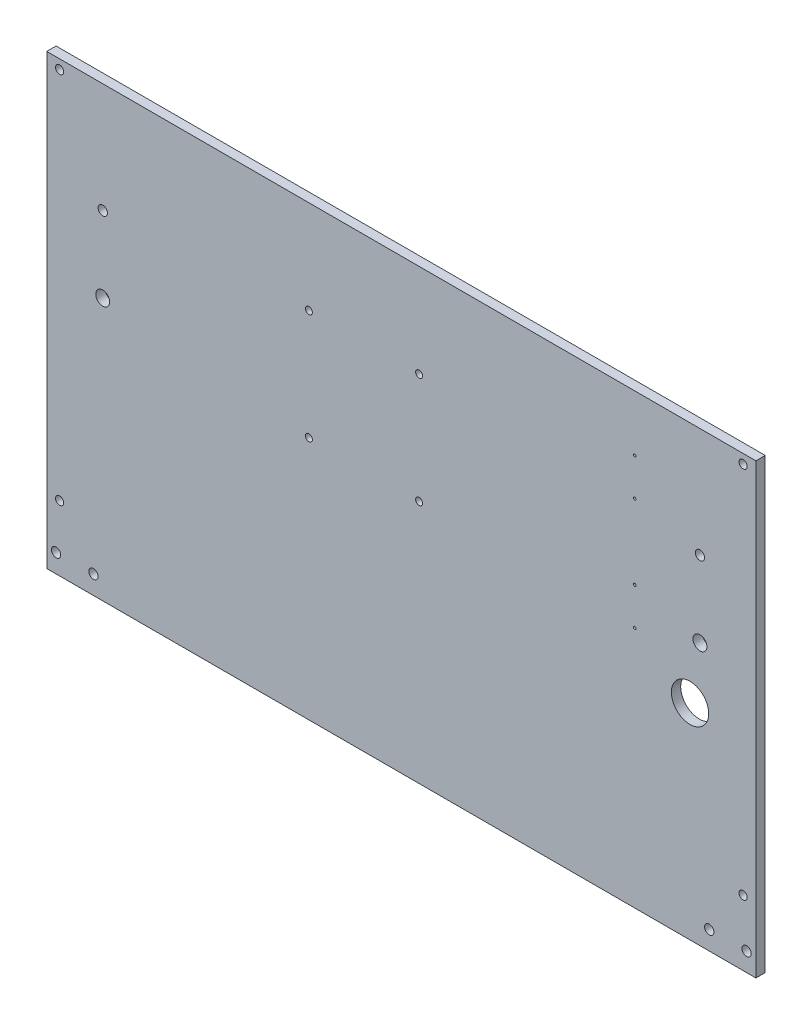
from build123d import *

# Parameters (mm, degrees)
SKETCH1_W           = 482.6
SKETCH1_H           = 304.8
BOSS_EXTRUDE1_DEPTH = 6.35
SKETCH2_R           = 2.7813
CUT_EXTRUDE1_DEPTH  = 286.467638271
SKETCH3_R           = 3.175
CUT_EXTRUDE2_DEPTH  = 286.467638271
SKETCH4_R           = 12.7
CUT_EXTRUDE3_DEPTH  = 286.467638271
SKETCH5_R           = 2.3749
CUT_EXTRUDE4_DEPTH  = 286.467638271
SKETCH6_R           = 3.175
SKETCH6_R_2         = 4.7625
CUT_EXTRUDE5_DEPTH  = 286.467638271
SKETCH7_R           = 0.889
CUT_EXTRUDE6_DEPTH  = 286.467638271


with BuildPart() as part:
    # Sketch1 → Boss-Extrude1 (new body)
    with BuildSketch(Plane.XY):
        Rectangle(SKETCH1_W, SKETCH1_H)
    extrude(amount=BOSS_EXTRUDE1_DEPTH)

    # Sketch2 → Cut-Extrude1 (cut, through all)
    with BuildSketch(Plane.XY.offset(6.35)):
        with Locations((-232.5624, 146.05)):
            Circle(SKETCH2_R)
        with Locations((-232.5624, -107.95)):
            Circle(SKETCH2_R)
    cut_extrude1 = extrude(amount=-CUT_EXTRUDE1_DEPTH, mode=Mode.SUBTRACT)

    # Mirror1: Cut-Extrude1 across plane
    add(cut_extrude1.mirror(Plane(origin=(0, 0, 0), x_dir=(0, 0, 1), z_dir=(1, 0, 0))), mode=Mode.SUBTRACT)

    # Sketch3 → Cut-Extrude2 (cut, through all)
    with BuildSketch(Plane.XY.offset(6.35)):
        with Locations((-234.95, -139.7)):
            Circle(SKETCH3_R)
        with Locations((-209.55, -139.7)):
            Circle(SKETCH3_R)
    cut_extrude2 = extrude(amount=-CUT_EXTRUDE2_DEPTH, mode=Mode.SUBTRACT)

    # Mirror2: Cut-Extrude2 across plane
    add(cut_extrude2.mirror(Plane(origin=(0, 0, 0), x_dir=(0, 0, 1), z_dir=(1, 0, 0))), mode=Mode.SUBTRACT)

    # Sketch4 → Cut-Extrude3 (cut, through all)
    with BuildSketch(Plane.XY.offset(6.35)):
        with Locations((196.469, -12.7)):
            Circle(SKETCH4_R)
    extrude(amount=-CUT_EXTRUDE3_DEPTH, mode=Mode.SUBTRACT)

    # Sketch5 → Cut-Extrude4 (cut, through all)
    with BuildSketch(Plane.XY.offset(6.35)):
        with Locations((-62.9, 88.9)):
            Circle(SKETCH5_R)
        with Locations((12.1, 88.9)):
            Circle(SKETCH5_R)
        with Locations((12.1, 13.9)):
            Circle(SKETCH5_R)
        with Locations((-62.9, 13.9)):
            Circle(SKETCH5_R)
    extrude(amount=-CUT_EXTRUDE4_DEPTH, mode=Mode.SUBTRACT)

    # Sketch6 → Cut-Extrude5 (cut, through all)
    with BuildSketch(Plane.XY.offset(6.35)):
        with Locations((-203.2, 77.727111167)):
            Circle(SKETCH6_R)
        with Locations((-203.2, 26.096105915)):
            Circle(SKETCH6_R_2)
        with Locations((203.2, 77.727111167)):
            Circle(SKETCH6_R)
        with Locations((203.2, 26.096105915)):
            Circle(SKETCH6_R_2)
    extrude(amount=-CUT_EXTRUDE5_DEPTH, mode=Mode.SUBTRACT)

    # Sketch7 → Cut-Extrude6 (cut, through all)
    with BuildSketch(Plane.XY.offset(6.35)):
        with Locations((158.821461806, 114.3)):
            Circle(SKETCH7_R)
        with Locations((158.821461806, 88.9)):
            Circle(SKETCH7_R)
        with Locations((158.821461806, 38.1)):
            Circle(SKETCH7_R)
        with Locations((158.821461806, 12.7)):
            Circle(SKETCH7_R)
    extrude(amount=-CUT_EXTRUDE6_DEPTH, mode=Mode.SUBTRACT)


solid = part.part
